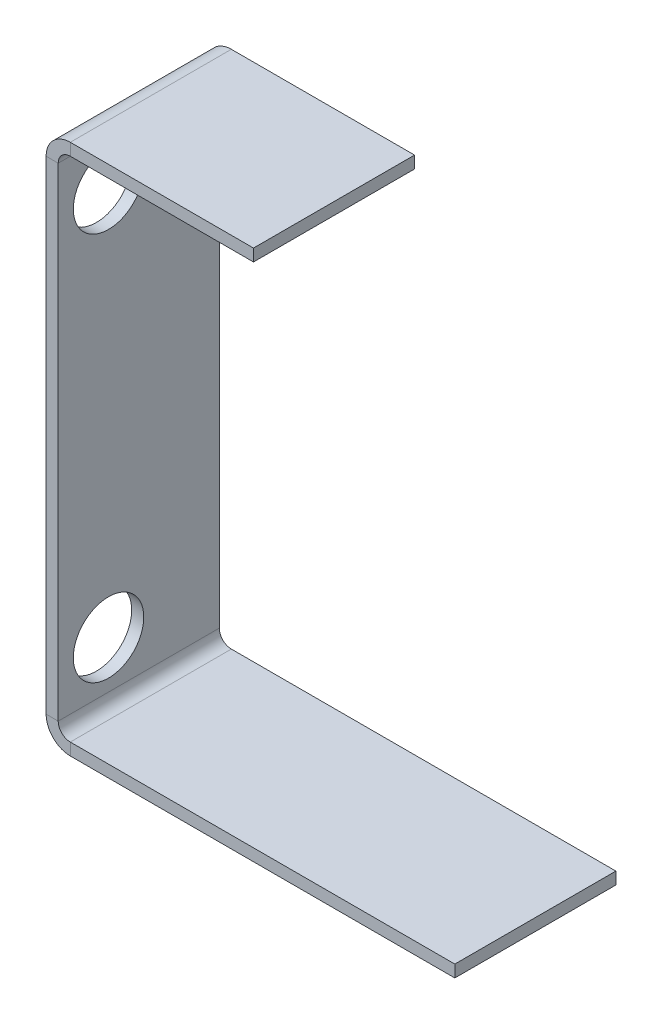
from build123d import *

# Parameters (mm, degrees)
SM_BASE_FLANGE_1_DEPTH = 80
SKETCH_6_R             = 17.5
CUT_EXTRUDE_1_DEPTH    = 10


# Sheet-metal steps are written as plain solids
with BuildPart() as part:
    # Sketch 1 → 基体-法兰1 (new body)
    with BuildSketch(Plane.XY):
        with BuildLine():
            Line((97, 0), (6, 0))
            ThreePointArc((6, 0), (1.757359313, -1.757359313), (0, -6))
            Line((0, -6), (0, -246))
            ThreePointArc((0, -246), (1.757359313, -250.242640687), (6, -252))
            Line((6, -252), (197, -252))
            Line((197, -252), (197, -258))
            Line((197, -258), (6, -258))
            ThreePointArc((6, -258), (-2.485281374, -254.485281374), (-6, -246))
            Line((-6, -246), (-6, -6))
            ThreePointArc((-6, -6), (-2.485281374, 2.485281374), (6, 6))
            Line((6, 6), (97, 6))
            Line((97, 6), (97, 0))
        make_face()
    extrude(amount=SM_BASE_FLANGE_1_DEPTH)

    # 草图6 → 切除-拉伸1 (cut)
    with BuildSketch(Plane(origin=(-6, 0, 0), x_dir=(0, 0, -1), z_dir=(1, 0, 0))):
        with Locations(Location((-55, -29.5, 0), (0, 0, 90))):
            Circle(SKETCH_6_R)
        with Locations(Location((-55, -222.5, 0), (0, 0, 90))):
            Circle(SKETCH_6_R)
    extrude(amount=CUT_EXTRUDE_1_DEPTH, mode=Mode.SUBTRACT)


solid = part.part
